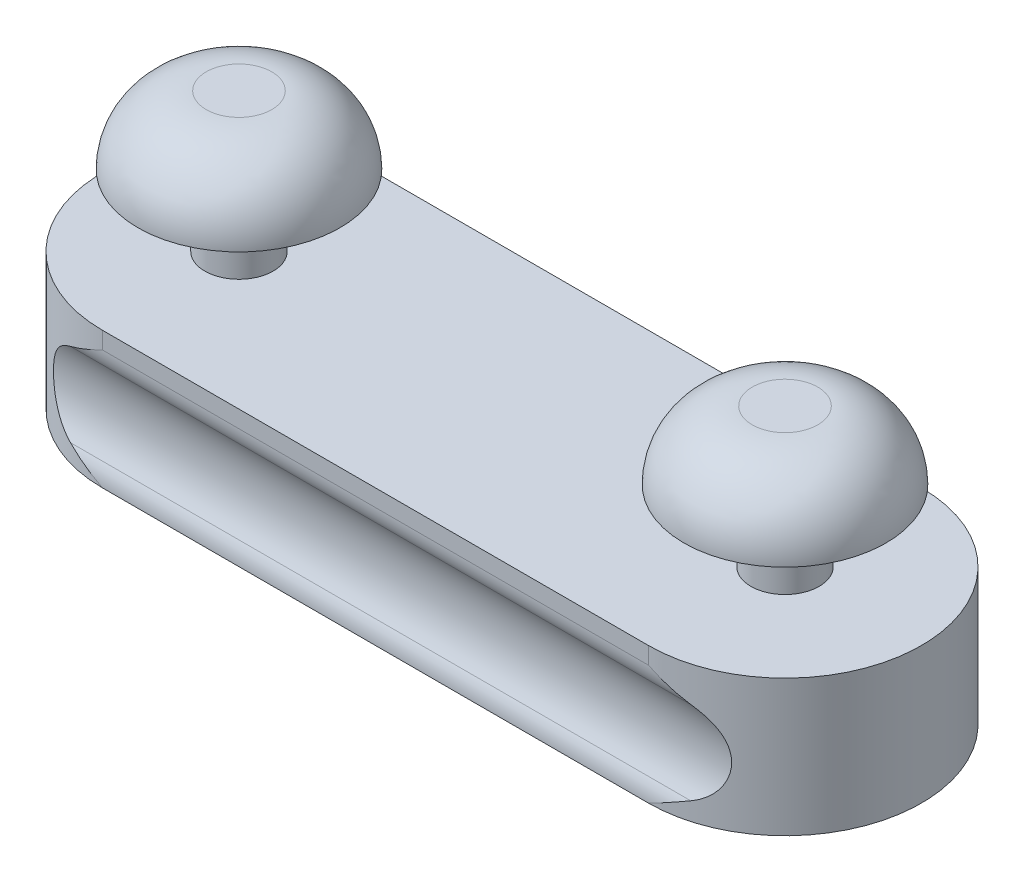
from build123d import *

# Parameters (mm, degrees)
SKETCH1_R           = 1.5875
BOSS_EXTRUDE1_DEPTH = 6.35
BOSS_EXTRUDE2_START = 6.35
SKETCH1_4_R         = 1.5875
BOSS_EXTRUDE2_DEPTH = 3.302
SKETCH2_R           = 4.699
BOSS_EXTRUDE3_DEPTH = 3.175
CUT_EXTRUDE1_DEPTH  = 20.32
FILLET1_R           = 3.175


with BuildPart() as part:
    # Sketch1 → Boss-Extrude1 (new body)
    # profile 1 of 3: a face of its own
    with BuildSketch(Plane(origin=(0, 0, 0), x_dir=(1, 0, 0), z_dir=(0, 1, 0))):
        with BuildLine():
            Line((-12.7, -6.35), (12.7, -6.35))
            ThreePointArc((12.7, -6.35), (19.05, 0), (12.7, 6.35))
            Line((12.7, 6.35), (-12.7, 6.35))
            ThreePointArc((-12.7, 6.35), (-19.05, 0), (-12.7, -6.35))
        make_face()
        with Locations((-12.7, 0)):
            Circle(SKETCH1_R, mode=Mode.SUBTRACT)
        with Locations((12.7, 0)):
            Circle(SKETCH1_R, mode=Mode.SUBTRACT)
    # profile 2 of 3: a face of its own
    with BuildSketch(Plane(origin=(0, 0, 0), x_dir=(1, 0, 0), z_dir=(0, 1, 0))):
        with Locations((-12.7, 0)):
            Circle(SKETCH1_R)
    # profile 3 of 3: a face of its own
    with BuildSketch(Plane(origin=(0, 0, 0), x_dir=(1, 0, 0), z_dir=(0, 1, 0))):
        with Locations((12.7, 0)):
            Circle(SKETCH1_R)
    extrude(amount=BOSS_EXTRUDE1_DEPTH)

    # Sketch1<4> → Boss-Extrude2 (add)
    with BuildSketch(Plane(origin=(0, 0, 0), x_dir=(1, 0, 0), z_dir=(0, 1, 0)).offset(BOSS_EXTRUDE2_START)):
        with Locations(Location((-12.7, 0, 0), (0, 0, 90))):
            Circle(SKETCH1_4_R)
        with Locations(Location((12.7, 0, 0), (0, 0, 90))):
            Circle(SKETCH1_4_R)
    extrude(amount=BOSS_EXTRUDE2_DEPTH)

    # Sketch2 → Boss-Extrude3 (add)
    with BuildSketch(Plane(origin=(0, 9.652, 0), x_dir=(1, 0, 0), z_dir=(0, 1, 0))):
        with Locations(Location((-12.7, 0, 0), (0, 0, 270))):
            Circle(SKETCH2_R)
        with Locations(Location((12.7, 0, 0), (0, 0, 270))):
            Circle(SKETCH2_R)
    extrude(amount=BOSS_EXTRUDE3_DEPTH)

    # Sketch3 → Cut-Extrude1 (cut, symmetric)
    with BuildSketch(Plane(origin=(0, 0, 0), x_dir=(0, 0, -1), z_dir=(1, 0, 0))):
        with BuildLine():
            Line((6.35, 0), (6.35, 5.55625))
            ThreePointArc((6.35, 5.55625), (6.288919267, 5.120130209), (6.110377358, 4.717570755))
            ThreePointArc((6.110377358, 4.717570755), (5.697499195, 3.786652016), (5.55625, 2.778125))
            ThreePointArc((5.55625, 2.778125), (5.697499195, 1.769597984), (6.110377358, 0.838679245))
            ThreePointArc((6.110377358, 0.838679245), (6.288919267, 0.436119791), (6.35, 0))
        make_face()
        with BuildLine():
            ThreePointArc((-6.110377358, 4.717570755), (-6.288919267, 5.120130209), (-6.35, 5.55625))
            Line((-6.35, 5.55625), (-6.35, 0))
            ThreePointArc((-6.35, 0), (-6.288919267, 0.436119791), (-6.110377358, 0.838679245))
            ThreePointArc((-6.110377358, 0.838679245), (-5.697499195, 1.769597984), (-5.55625, 2.778125))
            ThreePointArc((-5.55625, 2.778125), (-5.697499195, 3.786652016), (-6.110377358, 4.717570755))
        make_face()
    extrude(amount=CUT_EXTRUDE1_DEPTH, both=True, mode=Mode.SUBTRACT)

    # Fillet1
    fillet1_edges = [part.edges().sort_by_distance(p)[0] for p in [
        (-12.7, 12.827, -4.699),
        (12.7, 12.827, -4.699),
    ]]
    fillet(fillet1_edges, radius=FILLET1_R - 0.0001)  # a hair under: the kernel refuses the full size


solid = part.part
